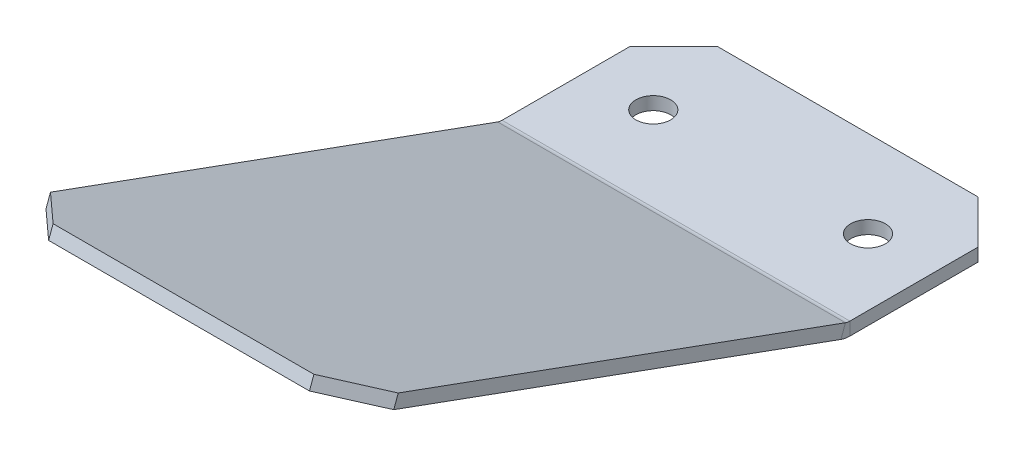
from build123d import *

# Parameters (mm, degrees)
SKETCH1_W                    = 40
SKETCH1_H                    = 20
BASE_FLANGE1_DEPTH           = 1.5
SKETCH4_R                    = 2
CUT_EXTRUDE1_DEPTH           = 10
EDGE_FLANGE1_STRIP_CUT_DEPTH = 40
EDGE_FLANGE1_DEPTH           = 40
CHAMFER1_SIZE                = 5


# Sheet-metal steps are written as plain solids
with BuildPart() as part:
    # Sketch1 → Base-Flange1 (new body)
    with BuildSketch(Plane(origin=(0, 0, 0), x_dir=(1, 0, 0), z_dir=(0, 1, 0))):
        Rectangle(SKETCH1_W, SKETCH1_H)
    extrude(amount=-BASE_FLANGE1_DEPTH)

    # Sketch4 → Cut-Extrude1 (cut)
    with BuildSketch(Plane(origin=(0, 0, 0), x_dir=(1, 0, 0), z_dir=(0, 1, 0))):
        with Locations(Location((-12.349279575, 0, 0), (0, 0, 270))):
            Circle(SKETCH4_R)
        with Locations(Location((12.349279575, 0, 0), (0, 0, 270))):
            Circle(SKETCH4_R)
    extrude(amount=-CUT_EXTRUDE1_DEPTH, mode=Mode.SUBTRACT)

    # Edge-Flange1 strip (across the edge) → Edge-Flange1 strip cut (cut)
    with BuildSketch(Plane(origin=(-20, 0, 10), x_dir=(0, 0.9396926207859105, -0.3420201433256631), z_dir=(1, 0, 0))):
        Polygon((-4.397259152, 7.695663628), (-1.319077862, -0.761569959), (0.090461069, -0.248539744), (-2.987720221, 8.208693843), align=None)
    extrude(amount=EDGE_FLANGE1_STRIP_CUT_DEPTH, mode=Mode.SUBTRACT)

    # Edge-Flange1 section (across the edge) → Edge-Flange1 (add)
    with BuildSketch(Plane(origin=(-20, 0, 10), x_dir=(0, 0.9396926207859105, -0.3420201433256631), z_dir=(1, 0, 0))):
        with BuildLine():
            Line((-1.5, 0.264490471), (-1.5, 60))
            Line((-1.5, 60), (0, 60))
            Line((0, 60), (0, 0.264490471))
            ThreePointArc((0, 0.264490471), (0.02278837, 0.004018205), (0.090461069, -0.248539744))
            Line((0.090461069, -0.248539744), (-1.319077862, -0.761569959))
            ThreePointArc((-1.319077862, -0.761569959), (-1.454423259, -0.256454062), (-1.5, 0.264490471))
        make_face()
    extrude(amount=EDGE_FLANGE1_DEPTH)

    # Chamfer1
    chamfer1_edges = [part.edges().sort_by_distance(p)[0] for p in [
        (-20, 19.816439134, 66.638072355),
        (20, 19.816439134, 66.638072355),
        (-20, -0.75, -10),
        (20, -0.75, -10),
    ]]
    chamfer(chamfer1_edges, length=CHAMFER1_SIZE)


solid = part.part
